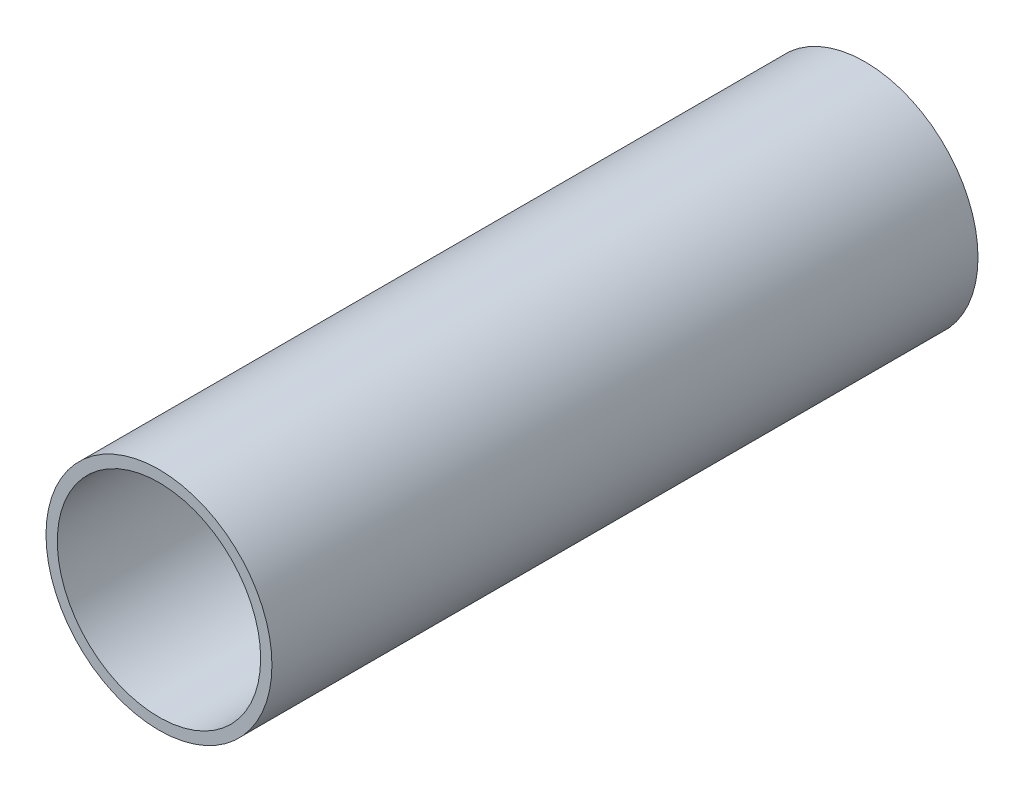
from build123d import *

# Parameters (mm, degrees)
SKETCH1_R           = 20
SKETCH1_R_2         = 18
BOSS_EXTRUDE1_DEPTH = 125


with BuildPart() as part:
    # Sketch1 → Boss-Extrude1 (new body)
    with BuildSketch(Plane.XY):
        Circle(SKETCH1_R)
        Circle(SKETCH1_R_2, mode=Mode.SUBTRACT)
    extrude(amount=BOSS_EXTRUDE1_DEPTH)


solid = part.part
